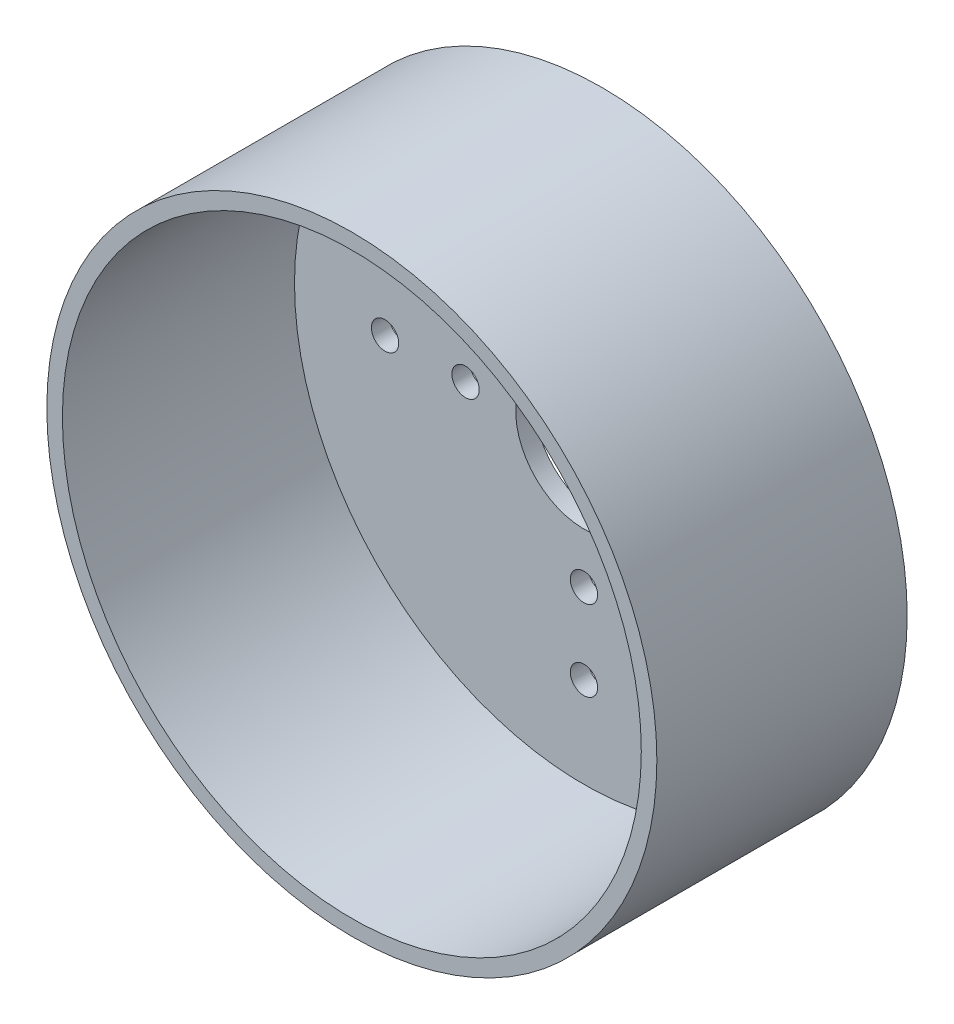
from build123d import *

# Parameters (mm, degrees)
SKETCH1_R           = 33.51
BOSS_EXTRUDE1_DEPTH = 2
SKETCH2_R           = 33.51
SKETCH2_R_2         = 31.8
BOSS_EXTRUDE2_DEPTH = 25.5
SKETCH3_R           = 1.5
CUT_EXTRUDE1_DEPTH  = 55.791333256
SKETCH4_R           = 7.5
CUT_EXTRUDE2_DEPTH  = 54.815334246


with BuildPart() as part:
    # Sketch1 → Boss-Extrude1 (new body)
    with BuildSketch(Plane.XY):
        Circle(SKETCH1_R)
    extrude(amount=BOSS_EXTRUDE1_DEPTH)

    # Sketch2 → Boss-Extrude2 (add)
    with BuildSketch(Plane.XY.offset(2)):
        Circle(SKETCH2_R)
        Circle(SKETCH2_R_2, mode=Mode.SUBTRACT)
    extrude(amount=BOSS_EXTRUDE2_DEPTH)

    # Sketch3 → Cut-Extrude1 (cut, through all)
    with BuildSketch(Plane(origin=(0, 0, 0), x_dir=(-1, 0, 0), z_dir=(0, 0, -1))):
        with Locations((21.85, 0)):
            Circle(SKETCH3_R)
        with Locations((13.01, 0)):
            Circle(SKETCH3_R)
        with Locations((0, -21.85)):
            Circle(SKETCH3_R)
        with Locations((0, -13.01)):
            Circle(SKETCH3_R)
        with Locations((-21.85, 0)):
            Circle(SKETCH3_R)
        with Locations((-13.01, 0)):
            Circle(SKETCH3_R)
        with Locations((0, 21.85)):
            Circle(SKETCH3_R)
        with Locations((0, 13.01)):
            Circle(SKETCH3_R)
    extrude(amount=-CUT_EXTRUDE1_DEPTH, mode=Mode.SUBTRACT)

    # Sketch4 → Cut-Extrude2 (cut, through all)
    with BuildSketch(Plane.XY.offset(2)):
        Circle(SKETCH4_R)
    extrude(amount=-CUT_EXTRUDE2_DEPTH, mode=Mode.SUBTRACT)


solid = part.part
